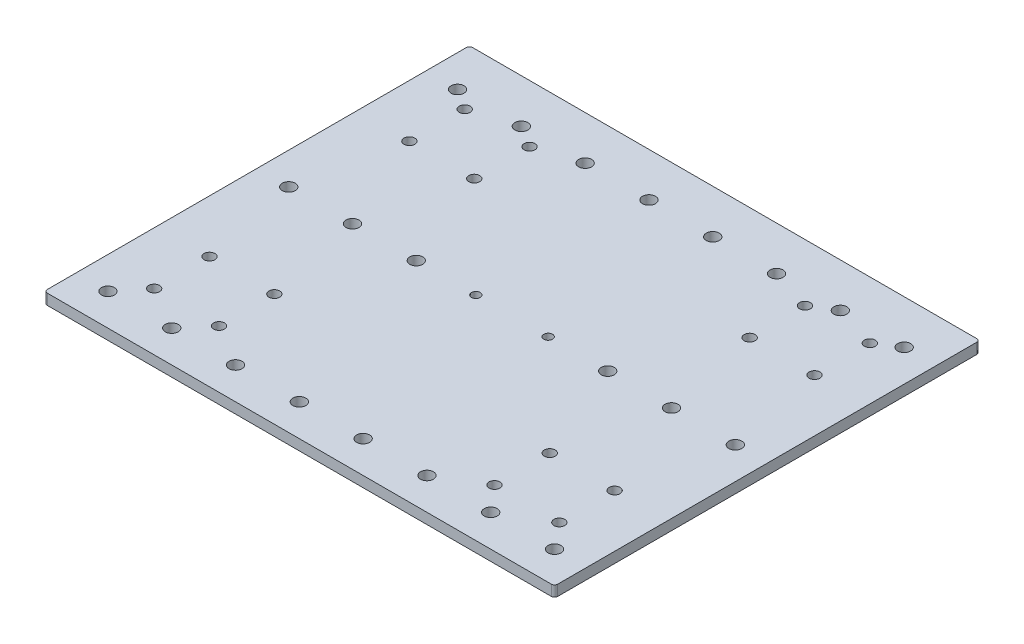
from build123d import *

# Parameters (mm, degrees)
SKETCH1_W           = 240
SKETCH1_H           = 200
BOSS_EXTRUDE1_DEPTH = 2.5
SKETCH2_R           = 2.55
CUT_EXTRUDE1_DEPTH  = 157.284996081
SKETCH3_R           = 2.05
CUT_EXTRUDE2_DEPTH  = 157.284996081
SKETCH4_R           = 3.05
CUT_EXTRUDE3_DEPTH  = 157.284996081
FILLET1_R           = 1.5


with BuildPart() as part:
    # Sketch1 → Boss-Extrude1 (new, symmetric)
    with BuildSketch(Plane(origin=(0, 0, 0), x_dir=(1, 0, 0), z_dir=(0, 1, 0))):
        Rectangle(SKETCH1_W, SKETCH1_H)
    extrude(amount=BOSS_EXTRUDE1_DEPTH, both=True)

    # Sketch2 → Cut-Extrude1 (cut, through all)
    with BuildSketch(Plane(origin=(0, 2.5, 0), x_dir=(1, 0, 0), z_dir=(0, 1, 0))):
        with Locations((-95.25, 73)):
            Circle(SKETCH2_R)
        with Locations((-95.25, 47)):
            Circle(SKETCH2_R)
        with Locations((-64.75, 73)):
            Circle(SKETCH2_R)
        with Locations((-64.75, 47)):
            Circle(SKETCH2_R)
        with Locations((-95.25, -47)):
            Circle(SKETCH2_R)
        with Locations((-95.25, -73)):
            Circle(SKETCH2_R)
        with Locations((-64.75, -73)):
            Circle(SKETCH2_R)
        with Locations((-64.75, -47)):
            Circle(SKETCH2_R)
        with Locations((95.25, -47)):
            Circle(SKETCH2_R)
        with Locations((64.75, -47)):
            Circle(SKETCH2_R)
        with Locations((64.75, -73)):
            Circle(SKETCH2_R)
        with Locations((95.25, -73)):
            Circle(SKETCH2_R)
        with Locations((64.75, 73)):
            Circle(SKETCH2_R)
        with Locations((64.75, 47)):
            Circle(SKETCH2_R)
        with Locations((95.25, 73)):
            Circle(SKETCH2_R)
        with Locations((95.25, 47)):
            Circle(SKETCH2_R)
    extrude(amount=-CUT_EXTRUDE1_DEPTH, mode=Mode.SUBTRACT)

    # Sketch3 → Cut-Extrude2 (cut, through all)
    with BuildSketch(Plane(origin=(0, 2.5, 0), x_dir=(1, 0, 0), z_dir=(0, 1, 0))):
        with Locations((-17, 0)):
            Circle(SKETCH3_R)
        with Locations((17, 0)):
            Circle(SKETCH3_R)
    extrude(amount=-CUT_EXTRUDE2_DEPTH, mode=Mode.SUBTRACT)

    # Sketch4 → Cut-Extrude3 (cut, through all)
    with BuildSketch(Plane(origin=(0, 2.5, 0), x_dir=(1, 0, 0), z_dir=(0, 1, 0))):
        with Locations((-105, 79.393522691)):
            Circle(SKETCH4_R)
        with Locations((-75, 79.393522691)):
            Circle(SKETCH4_R)
        with Locations((-45, 79.393522691)):
            Circle(SKETCH4_R)
        with Locations((-15, 79.393522691)):
            Circle(SKETCH4_R)
        with Locations((15, 79.393522691)):
            Circle(SKETCH4_R)
        with Locations((45, 79.393522691)):
            Circle(SKETCH4_R)
        with Locations((75, 79.393522691)):
            Circle(SKETCH4_R)
        with Locations((105, 79.393522691)):
            Circle(SKETCH4_R)
        with Locations((-105, 0)):
            Circle(SKETCH4_R)
        with Locations((-105, -85)):
            Circle(SKETCH4_R)
        with Locations((-75, 0)):
            Circle(SKETCH4_R)
        with Locations((-45, 0)):
            Circle(SKETCH4_R)
        with Locations((45, 0)):
            Circle(SKETCH4_R)
        with Locations((75, 0)):
            Circle(SKETCH4_R)
        with Locations((105, 0)):
            Circle(SKETCH4_R)
        with Locations((-75, -85)):
            Circle(SKETCH4_R)
        with Locations((-45, -85)):
            Circle(SKETCH4_R)
        with Locations((-15, -85)):
            Circle(SKETCH4_R)
        with Locations((15, -85)):
            Circle(SKETCH4_R)
        with Locations((45, -85)):
            Circle(SKETCH4_R)
        with Locations((75, -85)):
            Circle(SKETCH4_R)
        with Locations((105, -85)):
            Circle(SKETCH4_R)
    extrude(amount=-CUT_EXTRUDE3_DEPTH, mode=Mode.SUBTRACT)

    # Fillet1
    fillet1_edges = [part.edges().sort_by_distance(p)[0] for p in [
        (-120, 0, -100),
        (120, 0, -100),
        (-120, 0, 100),
        (120, 0, 100),
    ]]
    fillet(fillet1_edges, radius=FILLET1_R)


solid = part.part
